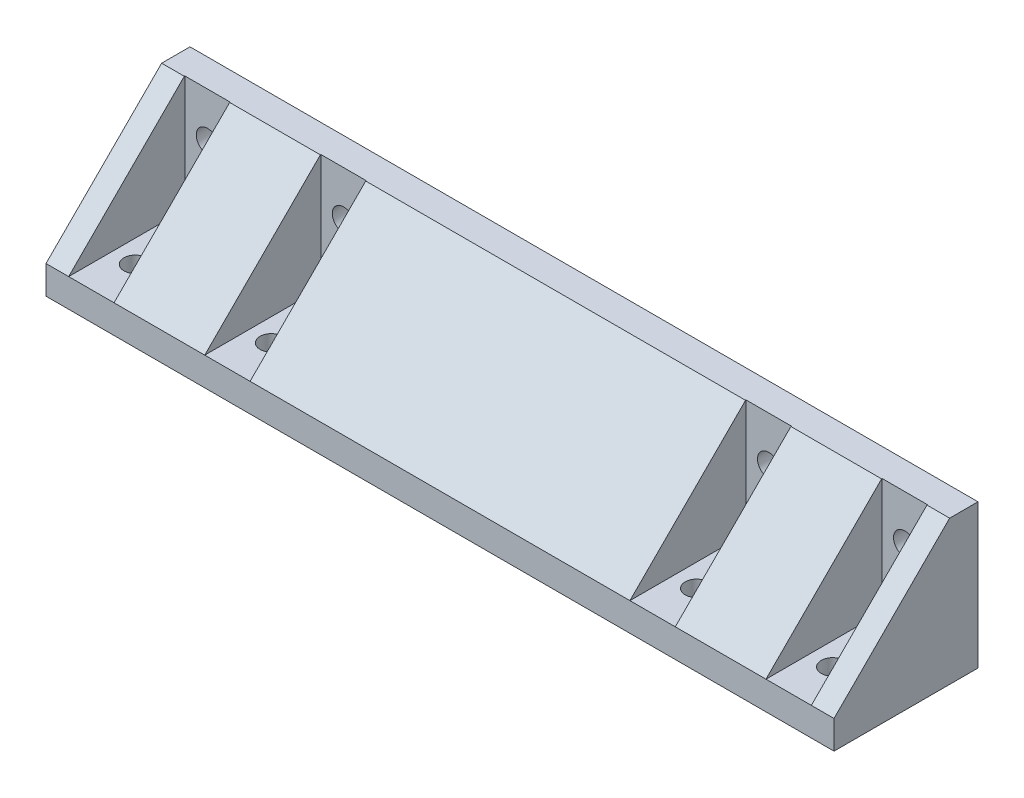
from build123d import *

# Parameters (mm, degrees)
SKETCH1_W               = 139
SKETCH1_H               = 25.4
SKETCH1_R               = 2
BOSS_EXTRUDE1_DEPTH     = 5
SKETCH3_W               = 139
SKETCH3_H               = 5
BOSS_EXTRUDE2_DEPTH     = 20.4
SKETCH4_W               = 139
SKETCH4_H               = 20.4
BOSS_EXTRUDE3_DEPTH     = 20.5
CUT_EXTRUDE1_DEPTH      = 144.584156508
CUT_EXTRUDE1_DEPTH_BACK = 144.584156508
SKETCH7_W               = 8
SKETCH7_H               = 20.4
CUT_EXTRUDE2_DEPTH      = 20.5
SKETCH8_R               = 2
CUT_EXTRUDE3_DEPTH      = 10


with BuildPart() as part:
    # Sketch1 → Boss-Extrude1 (new body)
    with BuildSketch(Plane(origin=(0, 0, 0), x_dir=(1, 0, 0), z_dir=(0, 1, 0))):
        with Locations((69.5, 12.7)):
            Rectangle(SKETCH1_W, SKETCH1_H)
        with Locations((8, 7.75)):
            Circle(SKETCH1_R, mode=Mode.SUBTRACT)
        with Locations((32, 7.75)):
            Circle(SKETCH1_R, mode=Mode.SUBTRACT)
        with Locations((107, 7.75)):
            Circle(SKETCH1_R, mode=Mode.SUBTRACT)
        with Locations((131, 7.75)):
            Circle(SKETCH1_R, mode=Mode.SUBTRACT)
        with Locations((8, 15.75)):
            Circle(SKETCH1_R, mode=Mode.SUBTRACT)
        with Locations((32, 15.75)):
            Circle(SKETCH1_R, mode=Mode.SUBTRACT)
        with Locations((107, 15.75)):
            Circle(SKETCH1_R, mode=Mode.SUBTRACT)
        with Locations((131, 15.75)):
            Circle(SKETCH1_R, mode=Mode.SUBTRACT)
    extrude(amount=BOSS_EXTRUDE1_DEPTH)

    # Sketch3 → Boss-Extrude2 (add)
    with BuildSketch(Plane(origin=(0, 5, 0), x_dir=(1, 0, 0), z_dir=(0, 1, 0))):
        with Locations((69.5, 22.9)):
            Rectangle(SKETCH3_W, SKETCH3_H)
    extrude(amount=BOSS_EXTRUDE2_DEPTH)

    # Sketch4 → Boss-Extrude3 (add)
    with BuildSketch(Plane(origin=(0, 5, 0), x_dir=(1, 0, 0), z_dir=(0, 1, 0))):
        with Locations((69.5, 10.2)):
            Rectangle(SKETCH4_W, SKETCH4_H)
    extrude(amount=BOSS_EXTRUDE3_DEPTH)

    # Sketch5 → Cut-Extrude1 (cut, two sides: drawn at the far end of the back side and taken through both)
    with BuildSketch(Plane(origin=(139, 0, 0), x_dir=(0, 0, -1), z_dir=(1, 0, 0)).offset(-CUT_EXTRUDE1_DEPTH_BACK)):
        Polygon((0, 5), (20.4, 25.4), (20.4, 25.5), (0, 25.5), align=None)
    extrude(amount=CUT_EXTRUDE1_DEPTH + CUT_EXTRUDE1_DEPTH_BACK, mode=Mode.SUBTRACT)

    # Sketch7 → Cut-Extrude2 (cut)
    with BuildSketch(Plane.XY):
        with Locations((131, 15.2)):
            Rectangle(SKETCH7_W, SKETCH7_H)
        with Locations((107, 15.2)):
            Rectangle(SKETCH7_W, SKETCH7_H)
        with Locations((32, 15.2)):
            Rectangle(SKETCH7_W, SKETCH7_H)
        with Locations((8, 15.2)):
            Rectangle(SKETCH7_W, SKETCH7_H)
    extrude(amount=-CUT_EXTRUDE2_DEPTH, mode=Mode.SUBTRACT)

    # Sketch8 → Cut-Extrude3 (cut)
    with BuildSketch(Plane.XY.offset(-20.5)):
        with Locations((8, 17.4)):
            Circle(SKETCH8_R)
        with Locations((32, 17.4)):
            Circle(SKETCH8_R)
        with Locations((107, 17.4)):
            Circle(SKETCH8_R)
        with Locations((131, 17.4)):
            Circle(SKETCH8_R)
    extrude(amount=-CUT_EXTRUDE3_DEPTH, mode=Mode.SUBTRACT)


solid = part.part
